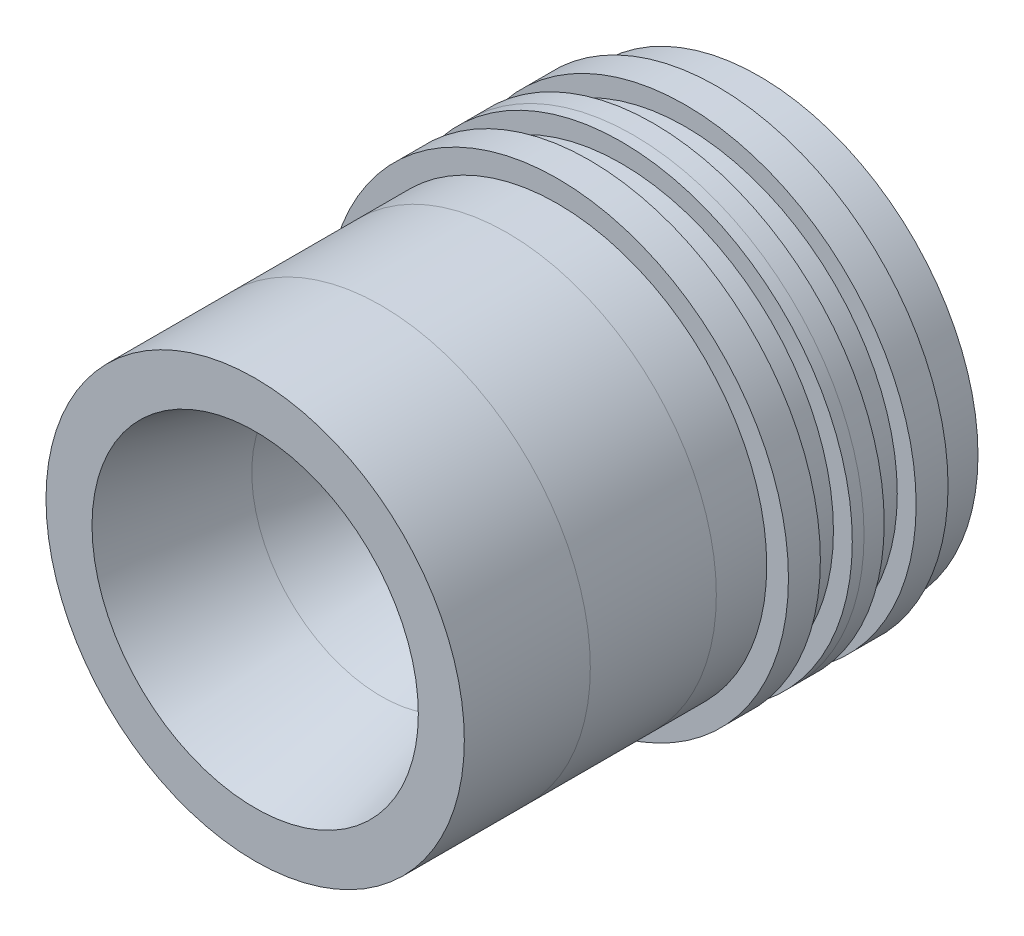
from build123d import *

# Parameters (mm, degrees)
SKETCH2_W        = 6.35
SKETCH2_H        = 9.652
SKETCH3_W        = 44.45
SKETCH3_H        = 76.198690687
SPLIT1_START     = -114.3
SPLIT1_OUTLINE_R = 69.8119
SPLIT1_DEPTH     = 114.3


# Read off the part's stored shape, not the designer's step: Split1
with BuildPart() as part:
    # Sketch1 → Revolve1 (revolve)
    with BuildSketch(Plane(origin=(0, 0, 0), x_dir=(1, 0, 0), z_dir=(0, 1, 0))):
        Polygon((69.8119, 139.7), (69.8119, 91.44), (63.246, 91.44), (63.246, 0), (49.337302706, 0), (17.145, 120.143309313), (17.145, 127.763309313), (59.817, 152.4), (66.167, 152.4), (66.167, 139.7), align=None)
    revolve(axis=Axis((0, 0, 8.145225657), (0, 0, -1)))

    # Sketch2 → Cut-Revolve1 (revolve, cut)
    with BuildSketch(Plane(origin=(0, 0, 0), x_dir=(1, 0, 0), z_dir=(0, 1, 0))):
        with Locations((67.2846, 125.222)):
            Rectangle(SKETCH2_W, SKETCH2_H)
        with Locations((67.2846, 105.918)):
            Rectangle(SKETCH2_W, SKETCH2_H)
    revolve(axis=Axis((0, 0, 8.145225657), (0, 0, -1)), mode=Mode.SUBTRACT)

    # Sketch3 → Cut-Revolve2 (revolve, cut)
    with BuildSketch(Plane(origin=(0, 0, 0), x_dir=(1, 0, 0), z_dir=(0, 1, 0))):
        with Locations((22.225, 114.300654657)):
            Rectangle(SKETCH3_W, SKETCH3_H)
    revolve(axis=Axis((0, 0, 8.145225657), (0, 0, -1)), mode=Mode.SUBTRACT)

    # Split1 outline → Split1 (cut)
    with BuildSketch(Plane.XY.offset(SPLIT1_START)):
        Circle(SPLIT1_OUTLINE_R)
    extrude(amount=SPLIT1_DEPTH, mode=Mode.SUBTRACT)


with BuildPart() as body_2:
    # Split1 2 outline → Split1 2 (revolve)
    with BuildSketch(Plane.XZ):
        Polygon((39.128438475, -38.1), (28.919574243, -76.2), (63.246, -76.2), (63.246, -38.1), align=None)
    revolve(axis=Axis((0, 0, 0), (0, 0, 1)))


with BuildPart() as body_3:
    # Split1 3 outline → Split1 3 (revolve)
    with BuildSketch(Plane.XZ):
        Polygon((49.337302706, 0), (39.128438475, -38.1), (63.246, -38.1), (63.246, 0), align=None)
    revolve(axis=Axis((0, 0, 0), (0, 0, 1)))


with BuildPart() as body_4:
    # Split1 4 outline → Split1 4 (revolve)
    with BuildSketch(Plane.XZ):
        Polygon((44.45, -76.201309313), (44.45, -114.3), (69.8119, -114.3), (69.8119, -110.744), (64.1096, -110.744), (64.1096, -101.092), (69.8119, -101.092), (69.8119, -91.44), (63.246, -91.44), (63.246, -76.2), (28.919574243, -76.2), (28.919223414, -76.201309313), align=None)
    revolve(axis=Axis((0, 0, 0), (0, 0, 1)))


solid = Compound([part.part, body_2.part, body_3.part, body_4.part])
